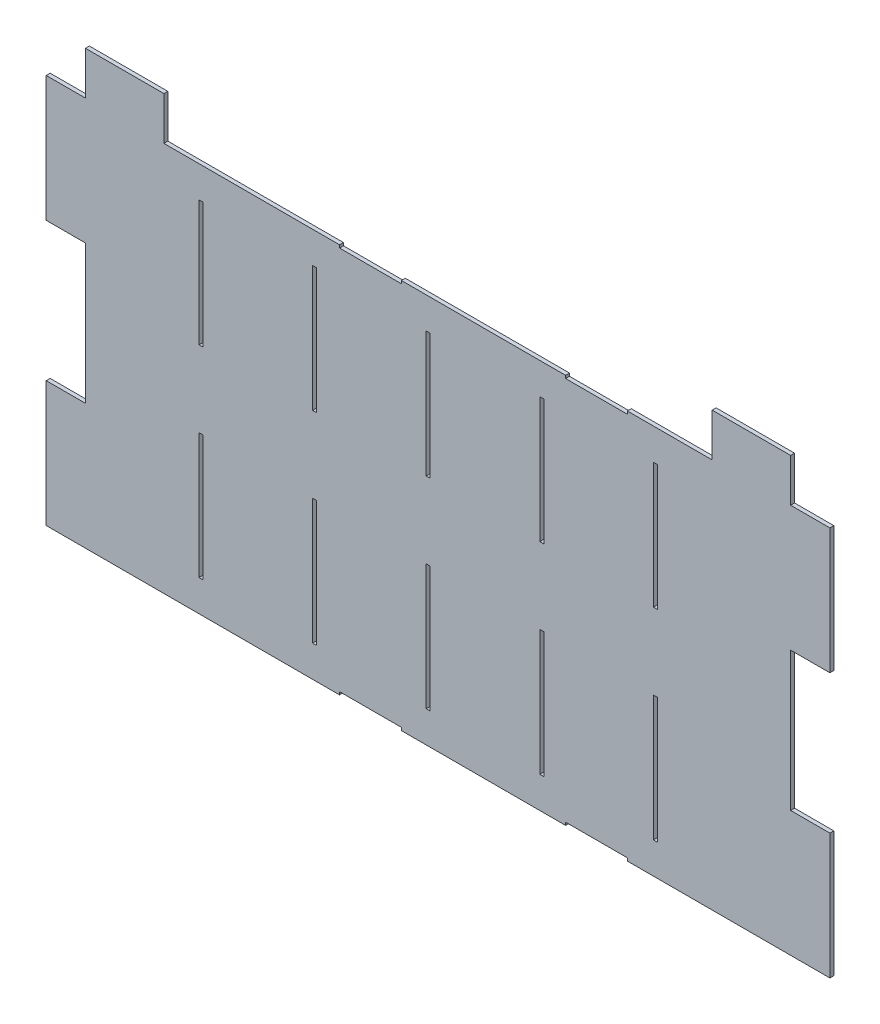
from build123d import *

# Parameters (mm, degrees)
SKETCH1_W                 = 570.860988324
SKETCH1_H                 = 315.575
BOSS_EXTRUDE1_DEPTH       = 3.175
SKETCH2_W                 = 3.175
SKETCH2_H                 = 101.6
CUT_EXTRUDE1_DEPTH        = 3.175
SKETCH7_W                 = 50
SKETCH7_H                 = 2.286
CUT_EXTRUDE5_DEPTH        = 3.175
LPATTERN2_COPY_1_SKETCH_W = 3.175
LPATTERN2_COPY_1_SKETCH_H = 101.6
LPATTERN2_COPY_1_DEPTH    = 3.175
LPATTERN2_COPY_2_SKETCH_W = 3.175
LPATTERN2_COPY_2_SKETCH_H = 101.6
LPATTERN2_COPY_2_DEPTH    = 3.175
LPATTERN2_COPY_3_SKETCH_W = 3.175
LPATTERN2_COPY_3_SKETCH_H = 101.6
LPATTERN2_COPY_3_DEPTH    = 3.175
LPATTERN2_COPY_4_SKETCH_W = 3.175
LPATTERN2_COPY_4_SKETCH_H = 101.6
LPATTERN2_COPY_4_DEPTH    = 3.175
LPATTERN2_COPY_5_SKETCH_W = 3.175
LPATTERN2_COPY_5_SKETCH_H = 101.6
LPATTERN2_COPY_5_DEPTH    = 3.175
LPATTERN2_COPY_6_SKETCH_W = 3.175
LPATTERN2_COPY_6_SKETCH_H = 101.6
LPATTERN2_COPY_6_DEPTH    = 3.175
LPATTERN2_COPY_7_SKETCH_W = 3.175
LPATTERN2_COPY_7_SKETCH_H = 101.6
LPATTERN2_COPY_7_DEPTH    = 3.175
LPATTERN2_COPY_8_SKETCH_W = 3.175
LPATTERN2_COPY_8_SKETCH_H = 101.6
LPATTERN2_COPY_8_DEPTH    = 3.175
SKETCH9_W                 = 63.5
SKETCH9_H                 = 34.925
SKETCH9_W_2               = 31.75
SKETCH9_H_2               = 101.6
BOSS_EXTRUDE3_DEPTH       = 3.175


with BuildPart() as part:
    # Sketch1 → Boss-Extrude1 (new body)
    with BuildSketch(Plane.XY):
        Rectangle(SKETCH1_W, SKETCH1_H)
    extrude(amount=BOSS_EXTRUDE1_DEPTH)

    # Sketch2 → Cut-Extrude1 (cut)
    with BuildSketch(Plane.XY.offset(3.175)):
        with Locations((-191.887994162, -81.5875)):
            Rectangle(SKETCH2_W, SKETCH2_H)
    cut_extrude1 = extrude(amount=-CUT_EXTRUDE1_DEPTH, mode=Mode.SUBTRACT)

    # Sketch7 → Cut-Extrude5 (cut)
    with BuildSketch(Plane.XY.offset(3.175)):
        with Locations((128.2695, -156.6445)):
            Rectangle(SKETCH7_W, SKETCH7_H)
        with Locations((-54.7305, -156.6445)):
            Rectangle(SKETCH7_W, SKETCH7_H)
    cut_extrude5 = extrude(amount=-CUT_EXTRUDE5_DEPTH, mode=Mode.SUBTRACT)

    # Mirror3: Cut-Extrude1 across plane
    add(cut_extrude1.mirror(Plane.ZX), mode=Mode.SUBTRACT)

    # LPattern2 copy 1 sketch → LPattern2 copy 1 (cut)
    with BuildSketch(Plane(origin=(91.96, 0, 3.175), x_dir=(1, 0, 0), z_dir=(0, 0, 1))):
        with Locations((-191.887994162, 81.5875)):
            Rectangle(LPATTERN2_COPY_1_SKETCH_W, LPATTERN2_COPY_1_SKETCH_H)
    extrude(amount=-LPATTERN2_COPY_1_DEPTH, mode=Mode.SUBTRACT)

    # LPattern2 copy 2 sketch → LPattern2 copy 2 (cut)
    with BuildSketch(Plane(origin=(183.92, 0, 3.175), x_dir=(1, 0, 0), z_dir=(0, 0, 1))):
        with Locations((-191.887994162, 81.5875)):
            Rectangle(LPATTERN2_COPY_2_SKETCH_W, LPATTERN2_COPY_2_SKETCH_H)
    extrude(amount=-LPATTERN2_COPY_2_DEPTH, mode=Mode.SUBTRACT)

    # LPattern2 copy 3 sketch → LPattern2 copy 3 (cut)
    with BuildSketch(Plane(origin=(275.88, 0, 3.175), x_dir=(1, 0, 0), z_dir=(0, 0, 1))):
        with Locations((-191.887994162, 81.5875)):
            Rectangle(LPATTERN2_COPY_3_SKETCH_W, LPATTERN2_COPY_3_SKETCH_H)
    extrude(amount=-LPATTERN2_COPY_3_DEPTH, mode=Mode.SUBTRACT)

    # LPattern2 copy 4 sketch → LPattern2 copy 4 (cut)
    with BuildSketch(Plane(origin=(367.84, 0, 3.175), x_dir=(1, 0, 0), z_dir=(0, 0, 1))):
        with Locations((-191.887994162, 81.5875)):
            Rectangle(LPATTERN2_COPY_4_SKETCH_W, LPATTERN2_COPY_4_SKETCH_H)
    extrude(amount=-LPATTERN2_COPY_4_DEPTH, mode=Mode.SUBTRACT)

    # LPattern2 copy 5 sketch → LPattern2 copy 5 (cut)
    with BuildSketch(Plane(origin=(91.96, 0, 3.175), x_dir=(1, 0, 0), z_dir=(0, 0, 1))):
        with Locations((-191.887994162, -81.5875)):
            Rectangle(LPATTERN2_COPY_5_SKETCH_W, LPATTERN2_COPY_5_SKETCH_H)
    extrude(amount=-LPATTERN2_COPY_5_DEPTH, mode=Mode.SUBTRACT)

    # LPattern2 copy 6 sketch → LPattern2 copy 6 (cut)
    with BuildSketch(Plane(origin=(183.92, 0, 3.175), x_dir=(1, 0, 0), z_dir=(0, 0, 1))):
        with Locations((-191.887994162, -81.5875)):
            Rectangle(LPATTERN2_COPY_6_SKETCH_W, LPATTERN2_COPY_6_SKETCH_H)
    extrude(amount=-LPATTERN2_COPY_6_DEPTH, mode=Mode.SUBTRACT)

    # LPattern2 copy 7 sketch → LPattern2 copy 7 (cut)
    with BuildSketch(Plane(origin=(275.88, 0, 3.175), x_dir=(1, 0, 0), z_dir=(0, 0, 1))):
        with Locations((-191.887994162, -81.5875)):
            Rectangle(LPATTERN2_COPY_7_SKETCH_W, LPATTERN2_COPY_7_SKETCH_H)
    extrude(amount=-LPATTERN2_COPY_7_DEPTH, mode=Mode.SUBTRACT)

    # LPattern2 copy 8 sketch → LPattern2 copy 8 (cut)
    with BuildSketch(Plane(origin=(367.84, 0, 3.175), x_dir=(1, 0, 0), z_dir=(0, 0, 1))):
        with Locations((-191.887994162, -81.5875)):
            Rectangle(LPATTERN2_COPY_8_SKETCH_W, LPATTERN2_COPY_8_SKETCH_H)
    extrude(amount=-LPATTERN2_COPY_8_DEPTH, mode=Mode.SUBTRACT)

    # Sketch9 → Boss-Extrude3 (add)
    with BuildSketch(Plane(origin=(0, 0, 0), x_dir=(-1, 0, 0), z_dir=(0, 0, -1))):
        with Locations((-253.680494162, 175.25)):
            Rectangle(SKETCH9_W, SKETCH9_H)
        Polygon((-285.430494162, 56.1875), (-285.430494162, 157.7875), (-301.305494162, 157.7875), (-317.180494162, 157.7875), (-317.180494162, 56.1875), align=None)
        with Locations((-301.305494162, -106.9875)):
            Rectangle(SKETCH9_W_2, SKETCH9_H_2)
    boss_extrude3 = extrude(amount=-BOSS_EXTRUDE3_DEPTH)

    # Mirror4: Boss-Extrude3 across plane
    add(boss_extrude3.mirror(Plane(origin=(0, 0, 0), x_dir=(0, 0, 1), z_dir=(1, 0, 0))))

    # Mirror5: Cut-Extrude5 across plane
    add(cut_extrude5.mirror(Plane.ZX), mode=Mode.SUBTRACT)


solid = part.part
